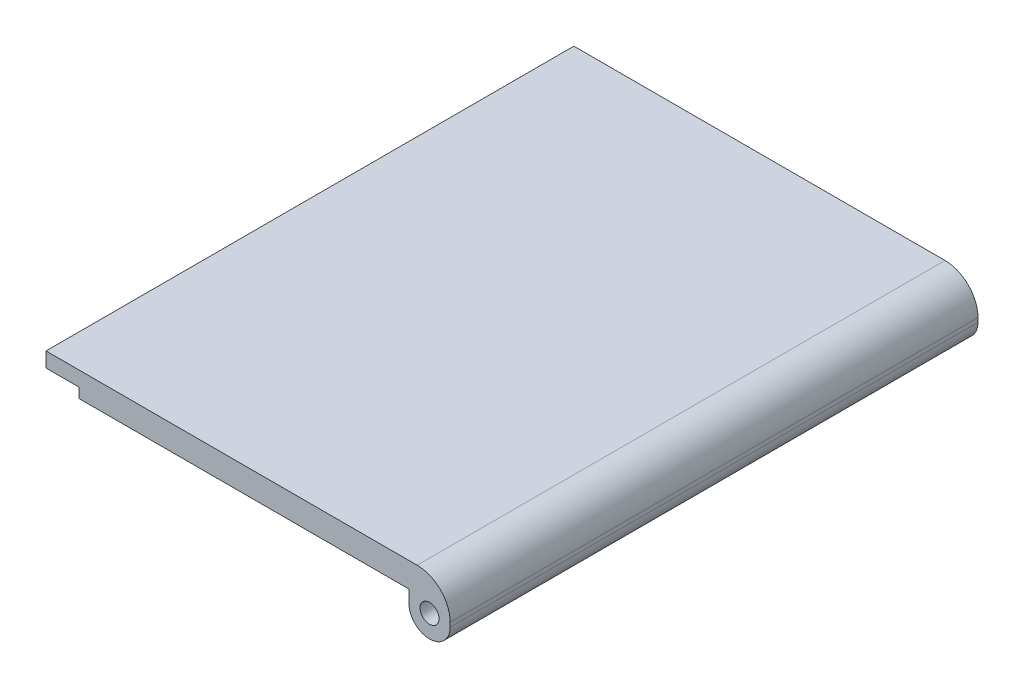
from build123d import *

# Parameters (mm, degrees)
SKETCH_1_W          = 49
SKETCH_1_H          = 64
EXTRUDE_1_DEPTH     = 3
SKETCH_2_W          = 5
SKETCH_2_H          = 64
EXTRUDE_2_DEPTH     = 4
SKETCH_3_R          = 1.15
CUT_EXTRUDE_2_DEPTH = 69.645830172
FILLET_1_R          = 2.5
FILLET_2_R          = 4
CUT_EXTRUDE_3_DEPTH = 1.2


with BuildPart() as part:
    # 草图1 → 凸台-拉伸1 (new body)
    with BuildSketch(Plane(origin=(0, 0, 0), x_dir=(1, 0, 0), z_dir=(0, 1, 0))):
        Rectangle(SKETCH_1_W, SKETCH_1_H)
    extrude(amount=EXTRUDE_1_DEPTH)

    # 草图2 → 凸台-拉伸2 (add)
    with BuildSketch(Plane(origin=(0, 0, 0), x_dir=(-1, 0, 0), z_dir=(0, -1, 0))):
        with Locations((-22, 0)):
            Rectangle(SKETCH_2_W, SKETCH_2_H)
    extrude(amount=EXTRUDE_2_DEPTH)

    # 草图3 → 切除-拉伸2 (cut, through all)
    with BuildSketch(Plane(origin=(0, 0, -32), x_dir=(-1, 0, 0), z_dir=(0, 0, -1))):
        with Locations((-22, -1.3)):
            Circle(SKETCH_3_R)
    extrude(amount=-CUT_EXTRUDE_2_DEPTH, mode=Mode.SUBTRACT)

    # 圆角1
    fillet_1_edges = [part.edges().sort_by_distance(p)[0] for p in [
        (24.5, -4, 0),
        (19.5, -4, 0),
    ]]
    fillet(fillet_1_edges, radius=FILLET_1_R - 0.0001)  # a hair under: the kernel refuses the full size

    # 圆角2
    fillet_2_edges = [part.edges().sort_by_distance(p)[0] for p in [
        (24.5, 3, 0),
    ]]
    fillet(fillet_2_edges, radius=FILLET_2_R)

    # 草图4 → 切除-拉伸3 (cut)
    with BuildSketch(Plane(origin=(0, 0, 0), x_dir=(-1, 0, 0), z_dir=(0, -1, 0))):
        with BuildLine():
            Line((24.5, -28), (24.5, -32))
            Line((24.5, -32), (20.5, -32))
            ThreePointArc((20.5, -32), (21.671572875, -29.171572875), (24.5, -28))
        make_face()
        with BuildLine():
            Line((24.5, 28), (24.5, 32))
            Line((24.5, 32), (20.5, 32))
            ThreePointArc((20.5, 32), (21.671572875, 29.171572875), (24.5, 28))
        make_face()
    extrude(amount=-CUT_EXTRUDE_3_DEPTH, mode=Mode.SUBTRACT)


solid = part.part
